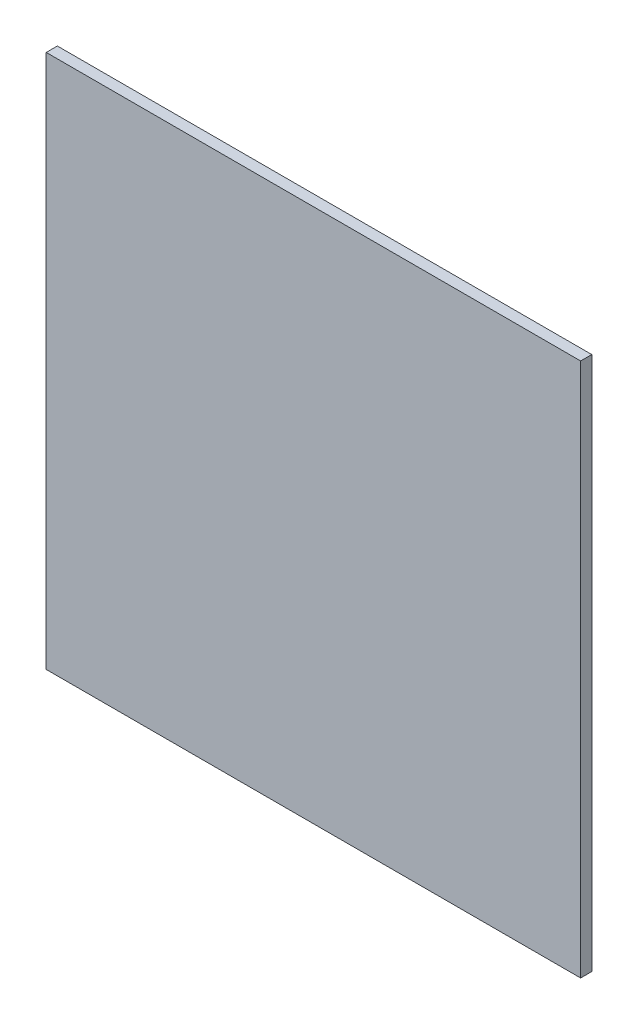
from build123d import *

# Parameters (mm, degrees)
SKETCH1_W           = 304.8
SKETCH1_H           = 304.8
BOSS_EXTRUDE1_DEPTH = 12.7
SKETCH2_W           = 12.7
SKETCH2_H           = 304.8
BOSS_EXTRUDE2_DEPTH = 304.8
SKETCH3_W           = 609.6
SKETCH3_H           = 12.7
BOSS_EXTRUDE3_DEPTH = 304.8


with BuildPart() as part:
    # Sketch1 → Boss-Extrude1 (new body)
    with BuildSketch(Plane.XY):
        with Locations((-60.739130435, 60.186956522)):
            Rectangle(SKETCH1_W, SKETCH1_H)
    extrude(amount=BOSS_EXTRUDE1_DEPTH)

    # Sketch2 → Boss-Extrude2 (add)
    with BuildSketch(Plane.ZY.offset(213.139130435)):
        with Locations((6.35, 60.186956522)):
            Rectangle(SKETCH2_W, SKETCH2_H)
    extrude(amount=BOSS_EXTRUDE2_DEPTH)

    # Sketch3 → Boss-Extrude3 (add)
    with BuildSketch(Plane.XZ.offset(92.213043478)):
        with Locations((-213.139130435, 6.35)):
            Rectangle(SKETCH3_W, SKETCH3_H)
    extrude(amount=BOSS_EXTRUDE3_DEPTH)


solid = part.part
